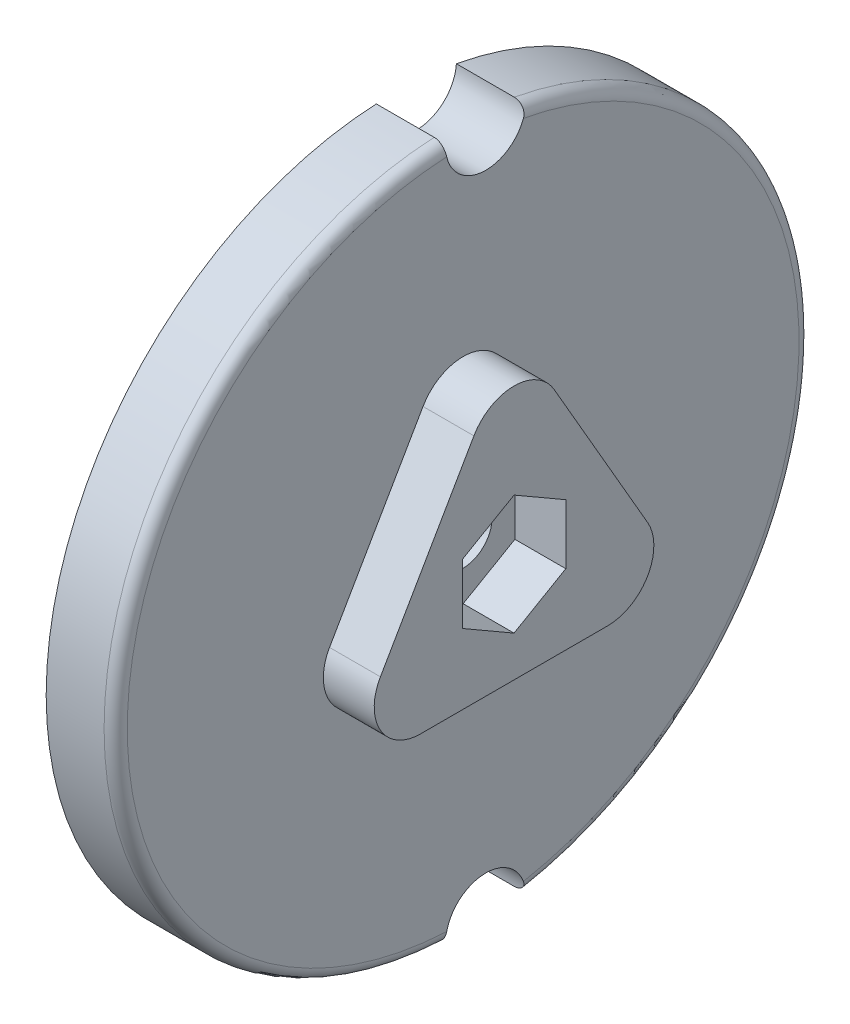
from build123d import *

# Parameters (mm, degrees)
SKETCH2_R           = 3.175
BOSS_EXTRUDE1_DEPTH = 7.62
BOSS_EXTRUDE2_DEPTH = 5.58
FILLET1_R           = 5.08
FILLET3_R           = 1.27


with BuildPart() as part:
    # Sketch2 → Boss-Extrude1 (new body)
    with BuildSketch(Plane(origin=(0, 0, 0), x_dir=(0, 0, -1), z_dir=(1, 0, 0))):
        with BuildLine():
            ThreePointArc((6.877601517, -37.474105691), (38.1, 0), (6.877601517, 37.474105691))
            ThreePointArc((6.877601517, 37.474105691), (2.197519386, 33.372298724), (-1.904287581, 38.052380856))
            ThreePointArc((-1.904287581, 38.052380856), (-38.1, 0), (-1.904287581, -38.052380856))
            ThreePointArc((-1.904287581, -38.052380856), (2.197519386, -33.372298724), (6.877601517, -37.474105691))
        make_face()
        Circle(SKETCH2_R, mode=Mode.SUBTRACT)
    extrude(amount=BOSS_EXTRUDE1_DEPTH)

    # Sketch3 → Boss-Extrude2 (add)
    with BuildSketch(Plane(origin=(7.62, 0, 0), x_dir=(0, 0, -1), z_dir=(1, 0, 0))):
        Polygon((19.05, -10.998522628), (0, 21.997045256), (-19.05, -10.998522628), align=None)
        Polygon((-5.675, 3.276462778), (-5.675, -3.276462778), (0, -6.552925555), (5.675, -3.276462778), (5.675, 3.276462778), (0, 6.552925555), align=None, mode=Mode.SUBTRACT)
    extrude(amount=BOSS_EXTRUDE2_DEPTH)

    # Fillet1
    fillet1_edges = [part.edges().sort_by_distance(p)[0] for p in [
        (10.41, -10.998522628, -19.05),
        (10.41, 21.997045256, 0),
        (10.41, -10.998522628, 19.05),
    ]]
    fillet(fillet1_edges, radius=FILLET1_R)

    # Fillet3
    fillet3_edges = [part.edges().sort_by_distance(p)[0] for p in [
        (7.62, 0, -38.1),
        (7.62, 0, 38.1),
    ]]
    fillet(fillet3_edges, radius=FILLET3_R)


solid = part.part
